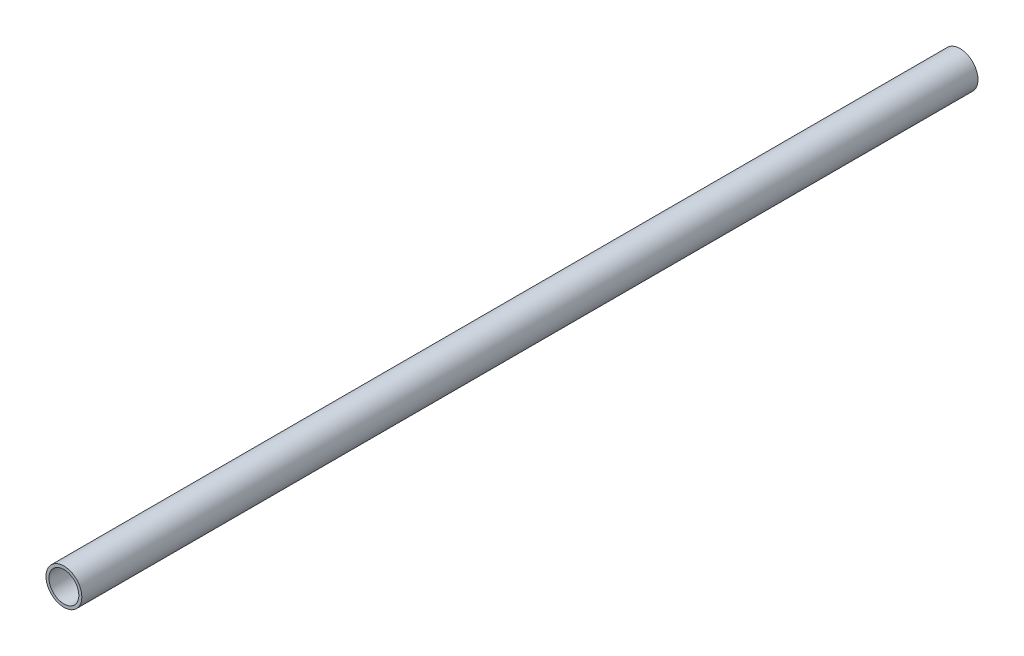
from build123d import *

# Parameters (mm, degrees)
SKETCH_1_R          = 6
EXTRUDE_1_DEPTH     = 300
SKETCH_2_R          = 5
CUT_EXTRUDE_1_DEPTH = 300


with BuildPart() as part:
    # 草图1 → 凸台-拉伸1 (new body)
    with BuildSketch(Plane.XY):
        Circle(SKETCH_1_R)
    extrude(amount=EXTRUDE_1_DEPTH)

    # 草图2 → 切除-拉伸1 (cut)
    with BuildSketch(Plane(origin=(0, 0, 0), x_dir=(-1, 0, 0), z_dir=(0, 0, -1))):
        Circle(SKETCH_2_R)
    extrude(amount=-CUT_EXTRUDE_1_DEPTH, mode=Mode.SUBTRACT)


solid = part.part
